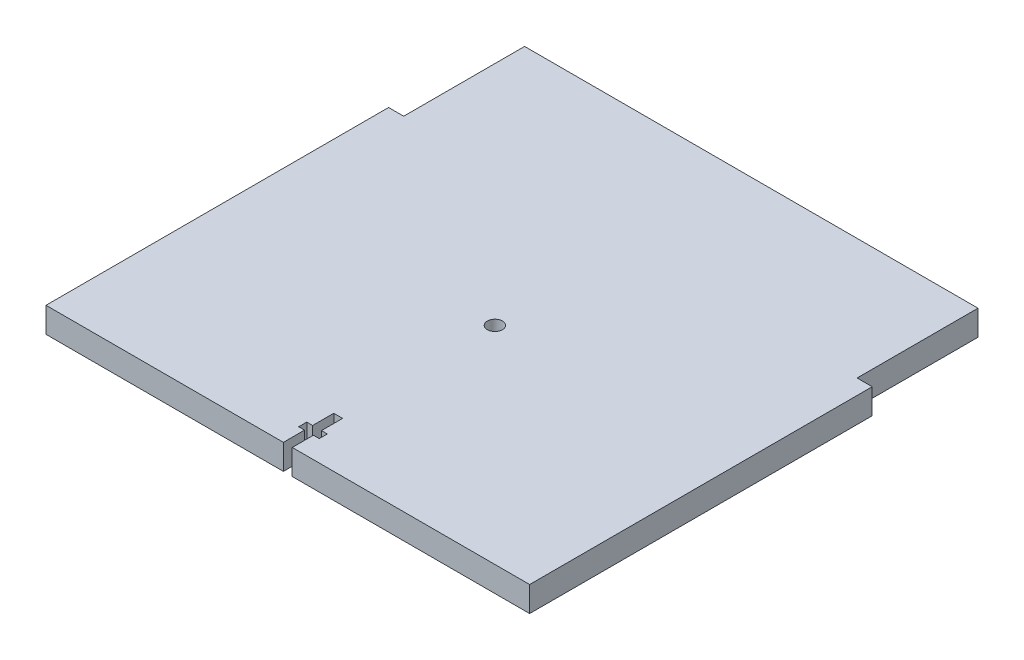
from build123d import *

# Parameters (mm, degrees)
BOSS_EXTRUDE1_DEPTH            = 7.9375
CUT_EXTRUDE2_DEPTH             = 208.823092587
F_3_16_0_1875_DIAMETER_HOLE1_D = 4.7625


with BuildPart() as part:
    # Sketch1 → Boss-Extrude1 (new body)
    with BuildSketch(Plane(origin=(0, 0, 0), x_dir=(1, 0, 0), z_dir=(0, 1, 0))):
        Polygon((0, 0), (142.875, 0), (147.6375, 0), (147.6375, 107.95), (142.875, 107.95), (142.875, 146.05), (0, 146.05), (0, 107.95), (-4.7625, 107.95), (-4.7625, 0), align=None)
    extrude(amount=BOSS_EXTRUDE1_DEPTH)

    # Sketch10 → Cut-Extrude2 (cut, through all)
    with BuildSketch(Plane(origin=(0, 7.9375, 0), x_dir=(1, 0, 0), z_dir=(0, 1, 0))):
        Polygon((70.0405, 9.2075), (68.199, 9.2075), (68.199, 6.6675), (70.0405, 6.6675), (70.0405, 0), (72.8345, 0), (72.8345, 6.6675), (74.676, 6.6675), (74.676, 9.2075), (72.8345, 9.2075), (72.8345, 15.875), (70.0405, 15.875), align=None)
    extrude(amount=-CUT_EXTRUDE2_DEPTH, mode=Mode.SUBTRACT)

    # 3/16 (0.1875) Diameter Hole1 (through all)
    with Locations(Plane(origin=(0, 0, 0), x_dir=(-1, 0, 0), z_dir=(0, -1, 0))):
        with Locations((-71.4375, 65.247038104)):
            Hole(F_3_16_0_1875_DIAMETER_HOLE1_D / 2)


solid = part.part
